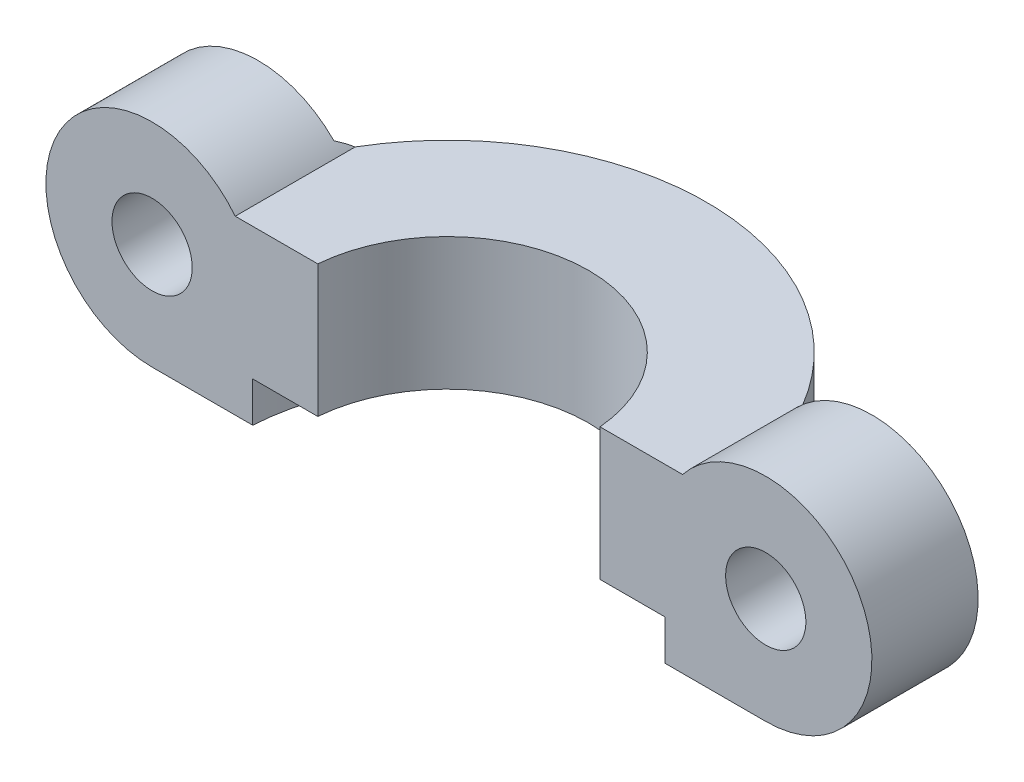
from build123d import *

# Parameters (mm, degrees)
SKETCH1_W            = 35
SKETCH1_H            = 12
BOSS_EXTRUDE1_DEPTH  = 7.5
SKETCH3_W            = 35
SKETCH3_H            = 0.5
CUT_EXTRUDE1_DEPTH   = 26.98557292
M3_CLEARANCE_HOLE1_D = 3.4
CUT_EXTRUDE2_DEPTH   = 26.98557292
SKETCH7_OUTSIDE_W    = 44.9
SKETCH7_OUTSIDE_H    = 24.9
SKETCH7_OUTSIDE_R    = 1.7
CUT_EXTRUDE3_DEPTH   = 22.742814905


with BuildPart() as part:
    # Sketch1 → Boss-Extrude1 (new, symmetric)
    with BuildSketch(Plane(origin=(0, 0, 0), x_dir=(1, 0, 0), z_dir=(0, 1, 0))):
        with Locations((0, 6)):
            Rectangle(SKETCH1_W, SKETCH1_H)
    extrude(amount=BOSS_EXTRUDE1_DEPTH, both=True)

    # Sketch2 → Cut-Revolve1 (revolve, cut)
    with BuildSketch(Plane.XY):
        Polygon((8.75, 7.5), (8.75, 2.8), (6, 2.8), (6, -2.8), (8.75, -2.8), (8.75, -7.5), (0, -7.5), (0, 7.5), align=None)
    revolve(axis=Axis((0, 7.5, 0), (0, -1, 0)), mode=Mode.SUBTRACT)

    # Sketch3 → Cut-Extrude1 (cut, through all)
    with BuildSketch(Plane(origin=(0, 7.5, 0), x_dir=(1, 0, 0), z_dir=(0, 1, 0))):
        with Locations((0, 0.25)):
            Rectangle(SKETCH3_W, SKETCH3_H)
    extrude(amount=-CUT_EXTRUDE1_DEPTH, mode=Mode.SUBTRACT)

    # M3 Clearance Hole1 (through all)
    with Locations(Plane(origin=(0, 0, -12), x_dir=(-1, 0, 0), z_dir=(0, 0, -1))):
        with Locations((13, 0), (-13, 0)):
            Hole(M3_CLEARANCE_HOLE1_D / 2)

    # Sketch6 → Cut-Extrude2 (cut, through all)
    with BuildSketch(Plane(origin=(0, 7.5, 0), x_dir=(1, 0, 0), z_dir=(0, 1, 0))):
        with BuildLine():
            Line((17.5, 5), (17.5, 12))
            Line((17.5, 12), (-17.5, 12))
            Line((-17.5, 12), (-17.5, 5))
            Line((-17.5, 5), (-9.797958971, 5))
            ThreePointArc((-9.797958971, 5), (0, 11), (9.797958971, 5))
            Line((9.797958971, 5), (17.5, 5))
        make_face()
    extrude(amount=-CUT_EXTRUDE2_DEPTH, mode=Mode.SUBTRACT)

    # Sketch7 outside → Cut-Extrude3 (cut, through all)
    # profile 1 of 2: a face of its own
    with BuildSketch(Plane.XY.offset(-0.5)):
        Rectangle(SKETCH7_OUTSIDE_W, SKETCH7_OUTSIDE_H)
        with BuildLine():
            ThreePointArc((-9.477217009, 2.8), (-17.052776826, 1.955760722), (-13, -4.5))
            Line((-13, -4.5), (13, -4.5))
            ThreePointArc((13, -4.5), (17.052776826, 1.955760722), (9.477217009, 2.8))
            Line((9.477217009, 2.8), (-9.477217009, 2.8))
        make_face(mode=Mode.SUBTRACT)
    # profile 2 of 2: a face of its own
    with BuildSketch(Plane.XY.offset(-0.5)):
        with Locations((13, 0)):
            Circle(SKETCH7_OUTSIDE_R)
    extrude(amount=-CUT_EXTRUDE3_DEPTH, mode=Mode.SUBTRACT)


solid = part.part
